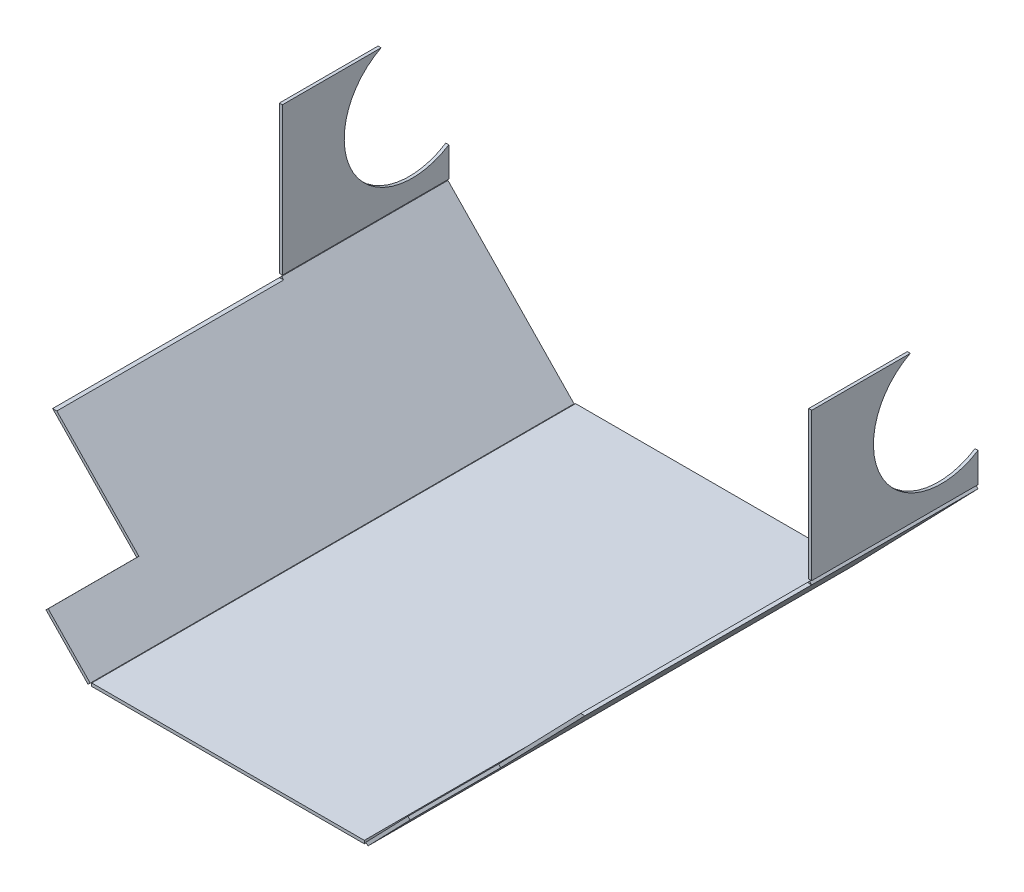
from build123d import *

# Parameters (mm, degrees)
BOSS_EXTRU_1_DEPTH           = 320
ESQUISSE2_W                  = 2
ESQUISSE2_H                  = 97.60948201
BOSS_EXTRU_1_2_DEPTH         = 320
BOSS_EXTRU_1_3_DEPTH         = 320
ESQUISSE2_W_2                = 180.264962804
ESQUISSE2_H_2                = 2
BOSS_EXTRU_1_4_DEPTH         = 320
BOSS_EXTRU_1_5_DEPTH         = 320
ENL_V_MAT_EXTRU_1_DEPTH      = 379.650234385
ENL_V_MAT_EXTRU_1_DEPTH_BACK = 379.650234385
ESQUISSE3_W                  = 210
ESQUISSE3_H                  = 100
ESQUISSE4_W                  = 60
ESQUISSE4_H                  = 80
ENL_V_MAT_EXTRU_2_DEPTH      = 458.137038923
ENL_V_START                  = -352
ENL_V_MAT_EXTRU_3_DEPTH      = 352


# Read off the part's stored shape, not the designer's step: Enlèv. mat.-Extru.3
with BuildPart() as part:
    # Esquisse2 → Boss.-Extru.1 (new body)
    with BuildSketch(Plane.XY):
        Polygon((-92.57, -86.25), (-176, 0), (-174.562481402, 1.39051799), (-91.132481402, -84.85948201), align=None)
    extrude(amount=BOSS_EXTRU_1_DEPTH)


with BuildPart() as body_2:
    # Esquisse2 → Boss.-Extru.1 2 (new body)
    with BuildSketch(Plane.XY):
        with Locations((-175, 51.195258995)):
            Rectangle(ESQUISSE2_W, ESQUISSE2_H)
    extrude(amount=BOSS_EXTRU_1_2_DEPTH)


with BuildPart() as body_3:
    # Esquisse2 → Boss.-Extru.1 3 (new body)
    with BuildSketch(Plane.XY):
        Polygon((92.57, -86.25), (176, 0), (174.562481402, 1.39051799), (91.132481402, -84.85948201), align=None)
    extrude(amount=BOSS_EXTRU_1_3_DEPTH)


with BuildPart() as body_4:
    # Esquisse2 → Boss.-Extru.1 4 (new body)
    with BuildSketch(Plane.XY):
        with Locations((0, -85.25)):
            Rectangle(ESQUISSE2_W_2, ESQUISSE2_H_2)
    extrude(amount=BOSS_EXTRU_1_4_DEPTH)


with BuildPart() as body_5:
    # Esquisse2 → Boss.-Extru.1 5 (new body)
    with BuildSketch(Plane.XY):
        with Locations((175, 51.195258995)):
            Rectangle(ESQUISSE2_W, ESQUISSE2_H)
    extrude(amount=BOSS_EXTRU_1_5_DEPTH)


with BuildPart() as enl_v_mat_extru_1_tool:
    # Esquisse3 → Enlèv. mat.-Extru.1 (new, two sides: drawn at the far end of the back side and taken through both)
    with BuildSketch(Plane(origin=(0, 0, 0), x_dir=(0, 0, -1), z_dir=(1, 0, 0)).offset(-ENL_V_MAT_EXTRU_1_DEPTH_BACK)):
        with Locations((-215, 50)):
            Rectangle(ESQUISSE3_W, ESQUISSE3_H)
    extrude(amount=ENL_V_MAT_EXTRU_1_DEPTH + ENL_V_MAT_EXTRU_1_DEPTH_BACK)


with BuildPart() as part_1:
    add(part.part)

    # Enlèv. mat.-Extru.1: cut by enl_v_mat_extru_1_tool
    add(enl_v_mat_extru_1_tool.part, mode=Mode.SUBTRACT)


with BuildPart() as body_2_1:
    add(body_2.part)

    # Enlèv. mat.-Extru.1: cut by enl_v_mat_extru_1_tool
    add(enl_v_mat_extru_1_tool.part, mode=Mode.SUBTRACT)


with BuildPart() as body_3_1:
    add(body_3.part)

    # Enlèv. mat.-Extru.1: cut by enl_v_mat_extru_1_tool
    add(enl_v_mat_extru_1_tool.part, mode=Mode.SUBTRACT)

    # Esquisse4 → Enlèv. mat.-Extru.2 (cut, symmetric)
    with BuildSketch(Plane(origin=(90.924227664, -87.951400742, 0), x_dir=(0, 0, -1), z_dir=(0.718759299008584, -0.6952589949714343, 0))):
        with Locations((-290, 82.365583115)):
            Rectangle(ESQUISSE4_W, ESQUISSE4_H)
    enl_v_mat_extru_2 = extrude(amount=ENL_V_MAT_EXTRU_2_DEPTH, both=True, mode=Mode.SUBTRACT)


with BuildPart() as body_5_1:
    add(body_5.part)

    # Enlèv. mat.-Extru.1: cut by enl_v_mat_extru_1_tool
    add(enl_v_mat_extru_1_tool.part, mode=Mode.SUBTRACT)


with BuildPart() as part_2:
    add(part_1.part)

    # Symétrie2: Enlèv. mat.-Extru.2 across plane
    add(enl_v_mat_extru_2.mirror(Plane(origin=(0, 0, 0), x_dir=(0, 0, 1), z_dir=(1, 0, 0))), mode=Mode.SUBTRACT)


with BuildPart() as enl_v_mat_extru_3_tool:
    # Enlèv. mat.-Extru.3 outline → Enlèv. mat.-Extru.3 (new body)
    with BuildSketch(Plane(origin=(176, 0, 0), x_dir=(0, 0, -1), z_dir=(1, 0, 0)).offset(ENL_V_START)):
        with BuildLine():
            Line((0, 100), (-44.765528128, 100))
            ThreePointArc((-44.765528128, 100), (-63.175407163, 37.594250832), (0, 22.029254682))
            Line((0, 22.029254682), (0, 100))
        make_face()
    extrude(amount=ENL_V_MAT_EXTRU_3_DEPTH)


with BuildPart() as body_2_2:
    add(body_2_1.part)

    # Enlèv. mat.-Extru.3: cut by enl_v_mat_extru_3_tool
    add(enl_v_mat_extru_3_tool.part, mode=Mode.SUBTRACT)


with BuildPart() as body_5_2:
    add(body_5_1.part)

    # Enlèv. mat.-Extru.3: cut by enl_v_mat_extru_3_tool
    add(enl_v_mat_extru_3_tool.part, mode=Mode.SUBTRACT)


solid = Compound([body_4.part, body_3_1.part, part_2.part, body_2_2.part, body_5_2.part])
